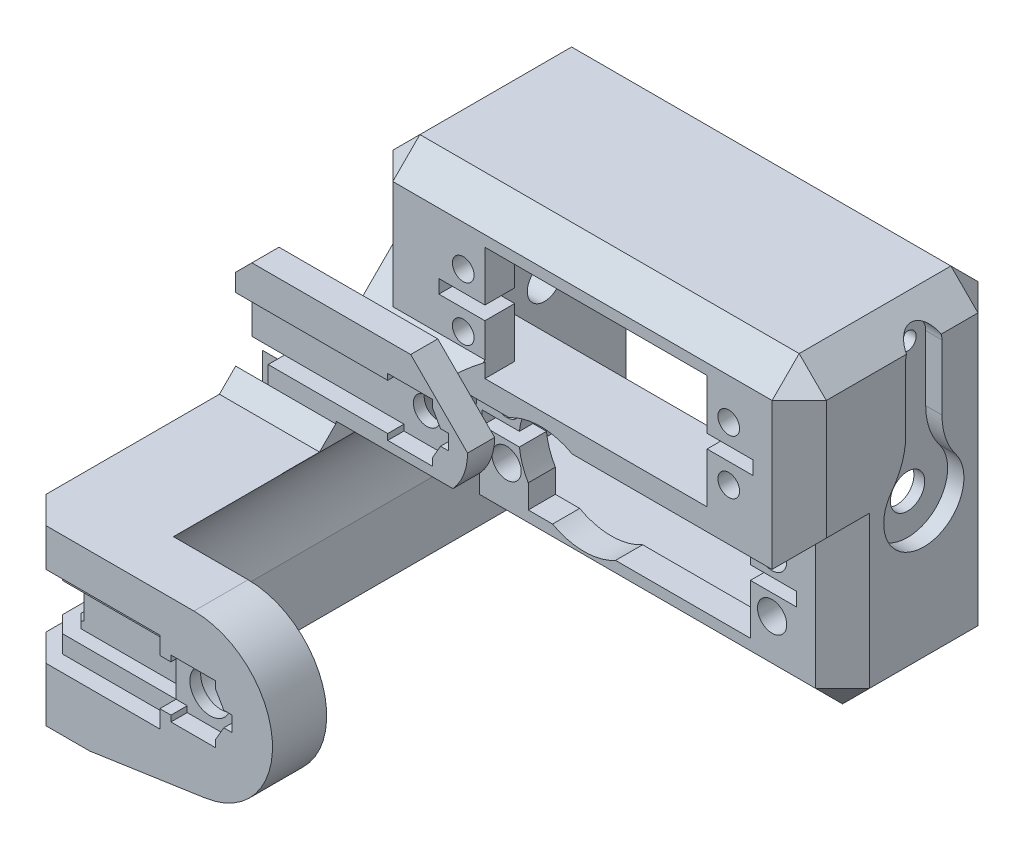
from build123d import *

# Parameters (mm, degrees)
ESQUISSE1_W               = 75
ESQUISSE1_H               = 60
BOSS_EXTRU_1_DEPTH        = 8
ESQUISSE2_W               = 41
ESQUISSE2_H               = 21
ENL_V_MAT_EXTRU_1_DEPTH   = 8
ESQUISSE3_W               = 8.5
ESQUISSE3_H               = 2.5
ENL_V_MAT_EXTRU_2_DEPTH   = 8
ESQUISSE4_R               = 2.7
ENL_V_MAT_EXTRU_3_DEPTH   = 49.685213361
SYM_TRIE4_COPY_1_SKETCH_W = 8.5
SYM_TRIE4_COPY_1_SKETCH_H = 2.5
SYM_TRIE4_COPY_1_DEPTH    = 8
SYM_TRIE4_COPY_2_SKETCH_R = 2.7
SYM_TRIE4_COPY_2_DEPTH    = 49.685213361
ESQUISSE6_W               = 75
ESQUISSE6_H               = 60
BOSS_EXTRU_2_DEPTH        = 35
ESQUISSE7_W               = 65
ESQUISSE7_H               = 50
ENL_V_MAT_EXTRU_4_DEPTH   = 35
CUT_EXTRUDE1_REACH        = 90.034
SKETCH1_W                 = 10
SKETCH1_H                 = 60
SKETCH2_W                 = 75
SKETCH2_H                 = 60
CUT_EXTRUDE2_DEPTH        = 3
SKETCH4_W                 = 30
SKETCH4_H                 = 60
BOSS_EXTRUDE2_DEPTH       = 5
CUT_EXTRUDE3_DEPTH        = 90.022469074
CUT_EXTRUDE3_DEPTH_BACK   = 90.022469074
SKETCH7_R                 = 3.175
SKETCH28_W                = 10
SKETCH28_H                = 12
BOSS_EXTRUDE7_DEPTH       = 3
CUT_EXTRUDE14_DEPTH       = 10
SKETCH31_W                = 10
SKETCH31_H                = 8
CUT_EXTRUDE17_DEPTH       = 10
SKETCH38_R                = 2
BOSS_EXTRUDE8_DEPTH       = 8
SKETCH39_W                = 65
SKETCH39_H                = 23
CUT_EXTRUDE22_DEPTH       = 7.5
BOSS_EXTRUDE9_DEPTH       = 72
SKETCH42_R                = 6.35
BOSS_EXTRUDE10_DEPTH      = 10
SKETCH43_R                = 14.5
SKETCH43_R_2              = 3.75
BOSS_EXTRUDE11_DEPTH      = 5
CUT_EXTRUDE23_DEPTH       = 3
SKETCH45_W                = 5
SKETCH45_H                = 21
BOSS_EXTRUDE12_DEPTH      = 45
CUT_EXTRUDE24_DEPTH       = 5
CUT_EXTRUDE25_DEPTH       = 3
SKETCH50_R                = 2.5
CUT_EXTRUDE26_DEPTH       = 5
CHAMFER1_SIZE             = 3
CUT_EXTRUDE29_DEPTH       = 5
CUT_EXTRUDE30_DEPTH       = 3
SKETCH53_R                = 1.6
CUT_EXTRUDE31_DEPTH       = 5
SKETCH54_W                = 19.063
SKETCH54_H                = 8.5
CUT_EXTRUDE32_DEPTH       = 3
SKETCH55_W                = 3
SKETCH55_H                = 8.5
CUT_EXTRUDE33_DEPTH       = 19.063
CUT_EXTRUDE35_REACH       = 116.5
SKETCH56_W                = 7
SKETCH56_H                = 1
CUT_EXTRUDE38_REACH       = 113.836
CUT_EXTRUDE39_START       = -25
SKETCH62_W                = 6
SKETCH62_H                = 5
CUT_EXTRUDE39_DEPTH       = 25
CUT_EXTRUDE40_START       = -5
SKETCH63_R                = 12
CUT_EXTRUDE40_DEPTH       = 5
CHAMFER3_SIZE             = 5
CUT_EXTRUDE41_DEPTH       = 24
CHAMFER4_SIZE             = 3
SKETCH65_W                = 3
SKETCH65_H                = 3
CUT_EXTRUDE42_DEPTH       = 3
SKETCH66_W                = 21.616473494
SKETCH66_H                = 4
CUT_EXTRUDE46_DEPTH       = 10
CUT_EXTRUDE48_REACH       = 116.5


with BuildPart() as part:
    # Esquisse1 → Boss.-Extru.1 (new body)
    with BuildSketch(Plane.XY):
        Rectangle(ESQUISSE1_W, ESQUISSE1_H)
    extrude(amount=-BOSS_EXTRU_1_DEPTH)

    # Esquisse2 → Enlèv. mat.-Extru.1 (cut)
    with BuildSketch(Plane.XY):
        with Locations((0, 12.5)):
            Rectangle(ESQUISSE2_W, ESQUISSE2_H)
    enl_v_mat_extru_1 = extrude(amount=-ENL_V_MAT_EXTRU_1_DEPTH, mode=Mode.SUBTRACT)

    # Esquisse3 → Enlèv. mat.-Extru.2 (cut)
    with BuildSketch(Plane.XY):
        with Locations((-24.75, 12.5)):
            Rectangle(ESQUISSE3_W, ESQUISSE3_H)
    enl_v_mat_extru_2 = extrude(amount=-ENL_V_MAT_EXTRU_2_DEPTH, mode=Mode.SUBTRACT)

    # Esquisse4 → Enlèv. mat.-Extru.3 (cut, through all)
    with BuildSketch(Plane.XY):
        with Locations((-24.5, 17.5)):
            Circle(ESQUISSE4_R)
        with Locations((-24.5, 7.5)):
            Circle(ESQUISSE4_R)
    enl_v_mat_extru_3 = extrude(amount=-ENL_V_MAT_EXTRU_3_DEPTH, mode=Mode.SUBTRACT)

    # Symétrie2: Enlèv. mat.-Extru.2, Enlèv. mat.-Extru.3 across plane
    add(enl_v_mat_extru_2.mirror(Plane(origin=(0, 0, 0), x_dir=(0, 0, 1), z_dir=(1, 0, 0))), mode=Mode.SUBTRACT)
    add(enl_v_mat_extru_3.mirror(Plane(origin=(0, 0, 0), x_dir=(0, 0, 1), z_dir=(1, 0, 0))), mode=Mode.SUBTRACT)

    # Symétrie4: Enlèv. mat.-Extru.1, Enlèv. mat.-Extru.2, Enlèv. mat.-Extru.3 across plane
    add(enl_v_mat_extru_1.mirror(Plane.ZX), mode=Mode.SUBTRACT)
    add(enl_v_mat_extru_2.mirror(Plane.ZX), mode=Mode.SUBTRACT)
    add(enl_v_mat_extru_3.mirror(Plane.ZX), mode=Mode.SUBTRACT)

    # Symétrie4 copy 1 sketch → Symétrie4 copy 1 (cut)
    with BuildSketch(Plane(origin=(0, 0, 0), x_dir=(-1, 0, 0), z_dir=(0, 0, 1))):
        with Locations((-24.75, 12.5)):
            Rectangle(SYM_TRIE4_COPY_1_SKETCH_W, SYM_TRIE4_COPY_1_SKETCH_H)
    extrude(amount=-SYM_TRIE4_COPY_1_DEPTH, mode=Mode.SUBTRACT)

    # Symétrie4 copy 2 sketch → Symétrie4 copy 2 (cut, through all)
    with BuildSketch(Plane(origin=(0, 0, 0), x_dir=(-1, 0, 0), z_dir=(0, 0, 1))):
        with Locations((-24.5, 17.5)):
            Circle(SYM_TRIE4_COPY_2_SKETCH_R)
        with Locations((-24.5, 7.5)):
            Circle(SYM_TRIE4_COPY_2_SKETCH_R)
    extrude(amount=-SYM_TRIE4_COPY_2_DEPTH, mode=Mode.SUBTRACT)

    # Esquisse6 → Boss.-Extru.2 (add)
    with BuildSketch(Plane.XY):
        Rectangle(ESQUISSE6_W, ESQUISSE6_H)
    extrude(amount=BOSS_EXTRU_2_DEPTH)

    # Esquisse7 → Enlèv. mat.-Extru.4 (cut)
    with BuildSketch(Plane.XY.offset(35)):
        Rectangle(ESQUISSE7_W, ESQUISSE7_H)
    extrude(amount=-ENL_V_MAT_EXTRU_4_DEPTH, mode=Mode.SUBTRACT)

    # Cut-Extrude1: up to this face of the body (flat: up to its plane)
    cut_extrude1_end = Plane(part.part.faces().sort_by_distance((-37.5, 0, 13.5))[0])
    # Sketch1 → Cut-Extrude1 (cut, up to the picked face)
    with BuildSketch(Plane(origin=(37.5, 0, 0), x_dir=(0, 0, -1), z_dir=(1, 0, 0)), mode=Mode.PRIVATE) as cut_extrude1_sk1:
        with Locations((-30, 0)):
            Rectangle(SKETCH1_W, SKETCH1_H)
    cut_extrude1_tool1 = split(extrude(cut_extrude1_sk1.sketch, amount=-CUT_EXTRUDE1_REACH, mode=Mode.PRIVATE), bisect_by=cut_extrude1_end, keep=Keep.BOTH, mode=Mode.PRIVATE)
    add(cut_extrude1_tool1.solids().sort_by(Axis((37.5, 0, 30), (-1, 0, 0)))[0], mode=Mode.SUBTRACT)

    # Sketch2 → Cut-Extrude2 (cut)
    with BuildSketch(Plane(origin=(0, 0, -8), x_dir=(-1, 0, 0), z_dir=(0, 0, -1))):
        Rectangle(SKETCH2_W, SKETCH2_H)
    extrude(amount=-CUT_EXTRUDE2_DEPTH, mode=Mode.SUBTRACT)

    # Sketch4 → Boss-Extrude2 (add)
    with BuildSketch(Plane.ZY.offset(37.5)):
        with Locations((10, 0)):
            Rectangle(SKETCH4_W, SKETCH4_H)
    extrude(amount=BOSS_EXTRUDE2_DEPTH)

    # Sketch7 → Cut-Extrude3 (cut, two sides: drawn at the far end of the back side and taken through both)
    with BuildSketch(Plane.ZY.offset(42.5).offset(-CUT_EXTRUDE3_DEPTH_BACK)):
        with Locations((10, 0)):
            Circle(SKETCH7_R)
    extrude(amount=CUT_EXTRUDE3_DEPTH + CUT_EXTRUDE3_DEPTH_BACK, mode=Mode.SUBTRACT)

    # Sketch28 → Boss-Extrude7 (add)
    with BuildSketch(Plane.ZY.offset(-32.5)):
        with Locations((10, 24)):
            Rectangle(SKETCH28_W, SKETCH28_H)
    extrude(amount=BOSS_EXTRUDE7_DEPTH)

    # Sketch27 → Cut-Extrude14 (cut)
    with BuildSketch(Plane.ZY.offset(-32.5)):
        Polygon((8.715395651, 26.225), (7.430791302, 24), (8.715395651, 21.775), (11.284604349, 21.775), (12.569208698, 24), (11.284604349, 26.225), align=None)
    extrude(amount=CUT_EXTRUDE14_DEPTH, mode=Mode.SUBTRACT)

    # Sketch31 → Cut-Extrude17 (cut)
    with BuildSketch(Plane.ZY.offset(-29.5)):
        with Locations((10, 23.5)):
            Rectangle(SKETCH31_W, SKETCH31_H)
    extrude(amount=CUT_EXTRUDE17_DEPTH, mode=Mode.SUBTRACT)

    # Sketch38 → Boss-Extrude8 (add)
    with BuildSketch(Plane(origin=(0, 0, -5), x_dir=(-1, 0, 0), z_dir=(0, 0, -1))):
        with BuildLine():
            Line((42.5, -2), (16.009475019, -2))
            ThreePointArc((16.009475019, -2), (10.2, -0.5), (4.390524981, -2))
            Line((4.390524981, -2), (-37.5, -2))
            Line((-37.5, -2), (-37.5, 30))
            Line((-37.5, 30), (42.5, 30))
            Line((42.5, 30), (42.5, -2))
        make_face()
        with Locations((-24.5, 17.5)):
            Circle(SKETCH38_R, mode=Mode.SUBTRACT)
        with Locations((-24.5, 7.5)):
            Circle(SKETCH38_R, mode=Mode.SUBTRACT)
        with Locations((24.5, 17.5)):
            Circle(SKETCH38_R, mode=Mode.SUBTRACT)
        with Locations((24.5, 7.5)):
            Circle(SKETCH38_R, mode=Mode.SUBTRACT)
        Polygon((-29, 13.75), (-20.5, 13.75), (-20.5, 23), (20.5, 23), (20.5, 13.75), (29, 13.75), (29, 11.25), (20.5, 11.25), (20.5, 2), (-20.5, 2), (-20.5, 11.25), (-29, 11.25), align=None, mode=Mode.SUBTRACT)
    extrude(amount=BOSS_EXTRUDE8_DEPTH)

    # Sketch39 → Cut-Extrude22 (cut)
    with BuildSketch(Plane.XY):
        with Locations((0, 13.5)):
            Rectangle(SKETCH39_W, SKETCH39_H)
    extrude(amount=-CUT_EXTRUDE22_DEPTH, mode=Mode.SUBTRACT)

    # Sketch40 → Boss-Extrude9 (add)
    with BuildSketch(Plane(origin=(0, 0, -5), x_dir=(-1, 0, 0), z_dir=(0, 0, -1))):
        with BuildLine():
            Line((23.974977314, 2), (42.5, 2))
            Line((42.5, 2), (42.5, -30))
            Line((42.5, -30), (29.473577412, -30))
            Line((29.473577412, -30), (29.473577412, -17.841274544))
            ThreePointArc((29.473577412, -17.841274544), (29.473577412, -7.158725456), (23.974977314, 2))
        make_face()
    extrude(amount=BOSS_EXTRUDE9_DEPTH)

    # Sketch42 → Boss-Extrude10 (add)
    with BuildSketch(Plane(origin=(0, 0, -77), x_dir=(-1, 0, 0), z_dir=(0, 0, -1))):
        with BuildLine():
            Line((42.5, -30), (29.473577412, -30))
            Line((29.473577412, -30), (8.08396994, -26.844769667))
            ThreePointArc((8.08396994, -26.844769667), (-4.261140345, -11.439141896), (10.2, 2))
            Line((10.2, 2), (42.5, 2))
            Line((42.5, 2), (42.5, -30))
        make_face()
        with Locations((10.2, -12.5)):
            Circle(SKETCH42_R, mode=Mode.SUBTRACT)
    extrude(amount=-BOSS_EXTRUDE10_DEPTH)

    # Sketch43 → Boss-Extrude11 (add)
    with BuildSketch(Plane(origin=(0, 0, -77), x_dir=(-1, 0, 0), z_dir=(0, 0, -1))):
        with Locations((10.2, -12.5)):
            Circle(SKETCH43_R)
        with Locations((10.2, -12.5)):
            Circle(SKETCH43_R_2, mode=Mode.SUBTRACT)
    extrude(amount=-BOSS_EXTRUDE11_DEPTH)

    # Sketch44 → Cut-Extrude23 (cut)
    with BuildSketch(Plane(origin=(0, 0, -77), x_dir=(-1, 0, 0), z_dir=(0, 0, -1))):
        Polygon((6.187, -7.15), (14.437, -7.15), (14.437, -8.25), (23.437, -8.25), (23.437, -16.75), (14.437, -16.75), (14.437, -17.85), (6.187, -17.85), (6.187, -16.498076211), (4.687, -13.9), (3.187, -13.9), (3.187, -11.1), (4.687, -11.1), (6.187, -8.501923789), align=None)
    extrude(amount=-CUT_EXTRUDE23_DEPTH, mode=Mode.SUBTRACT)

    # Sketch45 → Boss-Extrude12 (add)
    with BuildSketch(Plane.ZY.offset(42.5)):
        with Locations((-34.5, 12.5)):
            Rectangle(SKETCH45_W, SKETCH45_H)
    extrude(amount=-BOSS_EXTRUDE12_DEPTH)

    # Sketch46 → Cut-Extrude24 (cut)
    with BuildSketch(Plane(origin=(0, 0, -37), x_dir=(-1, 0, 0), z_dir=(0, 0, -1))):
        with BuildLine():
            Line((10.2, 23), (-2.5, 23))
            Line((-2.5, 23), (-2.5, 2))
            Line((-2.5, 2), (10.2, 2))
            ThreePointArc((10.2, 2), (-0.3, 12.5), (10.2, 23))
        make_face()
    extrude(amount=-CUT_EXTRUDE24_DEPTH, mode=Mode.SUBTRACT)

    # Sketch49 → Cut-Extrude25 (cut)
    with BuildSketch(Plane(origin=(0, 0, -37), x_dir=(-1, 0, 0), z_dir=(0, 0, -1))):
        Polygon((6.187, 17.85), (14.437, 17.85), (14.437, 16.75), (23.437, 16.75), (23.437, 8.25), (14.437, 8.25), (14.437, 7.15), (6.187, 7.15), (6.187, 8.501923789), (4.687, 11.1), (3.187, 11.1), (3.187, 13.9), (4.687, 13.9), (6.187, 16.498076211), align=None)
    extrude(amount=-CUT_EXTRUDE25_DEPTH, mode=Mode.SUBTRACT)

    # Sketch50 → Cut-Extrude26 (cut)
    with BuildSketch(Plane(origin=(0, 0, -37), x_dir=(-1, 0, 0), z_dir=(0, 0, -1))):
        with Locations(Location((10.2, 12.5, 0), (0, 0, 180))):
            Circle(SKETCH50_R)
    extrude(amount=-CUT_EXTRUDE26_DEPTH, mode=Mode.SUBTRACT)

    # Chamfer1
    # the kernel refuses this chamfer: 3 mm, written as the material it adds along each edge
    with BuildSketch(Plane(origin=(-16.25992835, 2, -13), x_dir=(0, 1, 0), z_dir=(-1, 0, 0))) as chamfer1_piece_1_section:
        Polygon((CHAMFER1_SIZE, 0), (0, CHAMFER1_SIZE), (0, 0), align=None)
    chamfer1_piece_1 = extrude(amount=26.24007165, mode=Mode.PRIVATE)
    chamfer1_piece_1 = chamfer1_piece_1 - Plane(origin=(-10.2, -12.5, -13), x_dir=(-0.9636788705869354, -0.26706372719687865, 0), z_dir=(0, 0, 1)) * Cylinder(20, 65, mode=Mode.PRIVATE)
    chamfer1_piece_1 = split(chamfer1_piece_1, bisect_by=Plane(origin=(-20.5, 2, -13), z_dir=(-1, 0, 0)), keep=Keep.TOP, mode=Mode.PRIVATE)
    add(chamfer1_piece_1)
    with BuildSketch(Plane(origin=(-42.5, 2, -37), x_dir=(0, 0, -1), z_dir=(1, 0, 0))) as chamfer1_piece_2_section:
        Polygon((CHAMFER1_SIZE, 0), (0, CHAMFER1_SIZE), (0, 0), align=None)
    chamfer1_piece_2 = extrude(amount=26.24007165, mode=Mode.PRIVATE)
    chamfer1_piece_2 = chamfer1_piece_2 - Plane(origin=(-10.2, -12.5, -37), x_dir=(-0.9636788705869354, -0.26706372719687865, 0), z_dir=(0, 0, 1)) * Cylinder(20, 65, mode=Mode.PRIVATE)
    add(chamfer1_piece_2)
    with BuildSketch(Plane(origin=(-42.5, 2, -32), x_dir=(0, 1, 0), z_dir=(1, 0, 0))) as chamfer1_piece_3_section:
        Polygon((CHAMFER1_SIZE, 0), (0, CHAMFER1_SIZE), (0, 0), align=None)
    chamfer1_piece_3 = extrude(amount=26.24007165, mode=Mode.PRIVATE)
    chamfer1_piece_3 = chamfer1_piece_3 - Plane(origin=(-10.2, -12.5, -32), x_dir=(-0.9636788705869354, -0.26706372719687865, 0), z_dir=(0, 0, 1)) * Cylinder(20, 65, mode=Mode.PRIVATE)
    add(chamfer1_piece_3)
    # the kernel refuses this chamfer: 3 mm, written as the material it takes off along each edge
    with BuildSketch(Plane(origin=(-42.5, 23, -44.715048964), x_dir=(1, 0, 0), z_dir=(0, 0, 1))) as chamfer1_2_piece_1:
        Polygon((CHAMFER1_SIZE, 0), (0, -CHAMFER1_SIZE), (0, 0), align=None)
    extrude(amount=20.430097928, mode=Mode.SUBTRACT)

    # Sketch51 → Cut-Extrude29 (cut)
    with BuildSketch(Plane(origin=(0, 0, -37), x_dir=(-1, 0, 0), z_dir=(0, 0, -1))):
        Polygon((10.2, 23), (-4.8, 8), (-4.8, 23), align=None)
    extrude(amount=-CUT_EXTRUDE29_DEPTH, mode=Mode.SUBTRACT)

    # Sketch52 → Cut-Extrude30 (cut)
    with BuildSketch(Plane(origin=(37.5, 0, 0), x_dir=(0, 0, -1), z_dir=(1, 0, 0))):
        with BuildLine():
            Line((-13.35, 12), (-13.35, 24))
            ThreePointArc((-13.35, 24), (-10, 27.35), (-6.65, 24))
            Line((-6.65, 24), (-6.65, 12))
            ThreePointArc((-6.65, 12), (-5.998758405, 8.033856538), (-4.113424043, 4.484219386))
            ThreePointArc((-4.113424043, 4.484219386), (-10, -7.4), (-15.886575957, 4.484219386))
            ThreePointArc((-15.886575957, 4.484219386), (-14.001241595, 8.033856538), (-13.35, 12))
        make_face()
    extrude(amount=-CUT_EXTRUDE30_DEPTH, mode=Mode.SUBTRACT)

    # Sketch53 → Cut-Extrude31 (cut)
    with BuildSketch(Plane(origin=(34.5, 0, 0), x_dir=(0, 0, -1), z_dir=(1, 0, 0))):
        with Locations((-10, 24)):
            Circle(SKETCH53_R)
    extrude(amount=-CUT_EXTRUDE31_DEPTH, mode=Mode.SUBTRACT)

    # Sketch54 → Cut-Extrude32 (cut)
    with BuildSketch(Plane(origin=(0, 0, -34), x_dir=(-1, 0, 0), z_dir=(0, 0, -1))):
        with Locations((32.9685, 12.5)):
            Rectangle(SKETCH54_W, SKETCH54_H)
    extrude(amount=CUT_EXTRUDE32_DEPTH, mode=Mode.SUBTRACT)

    # Sketch55 → Cut-Extrude33 (cut)
    with BuildSketch(Plane(origin=(-23.437, 0, 0), x_dir=(0, 0, -1), z_dir=(1, 0, 0))):
        with Locations((75.5, -12.5)):
            Rectangle(SKETCH55_W, SKETCH55_H)
    extrude(amount=-CUT_EXTRUDE33_DEPTH, mode=Mode.SUBTRACT)

    # Chamfer2
    # the kernel refuses this chamfer: 5 mm, written as the material it takes off along each edge
    with BuildSketch(Plane(origin=(34.166666667, 26.666666667, 21.666666667), x_dir=(0.7071067811865475, -0.7071067811865475, 0), z_dir=(0.577350269189626, 0.577350269189626, 0.5773502691896255)), Plane(origin=(34.166666667, -26.666666667, 21.666666667), x_dir=(-0.7071067811865475, -0.7071067811865475, 0), z_dir=(0.5773502691896257, -0.5773502691896257, 0.5773502691896257)), Plane(origin=(34.166666667, -26.666666667, -1.666666667), x_dir=(-0.7071067811865475, 0, -0.7071067811865475), z_dir=(0.5773502691896257, -0.5773502691896257, -0.5773502691896257)), Plane(origin=(-39.166666667, 26.666666667, -9.666666667), x_dir=(-0.707106781186547, -0.707106781186548, 0), z_dir=(-0.577350269189626, 0.5773502691896253, -0.577350269189626))) as chamfer2_piece_1:
        Polygon((-3.535533906, 2.041241452), (3.535533906, 2.041241452), (0, -4.082482905), align=None)
    extrude(amount=6.350852961, mode=Mode.SUBTRACT)
    with BuildSketch(Plane(origin=(-39.166666667, 26.666666667, 21.666666667), x_dir=(-0.7071067811865466, -0.7071067811865486, 0), z_dir=(-0.5773502691896267, 0.5773502691896251, 0.5773502691896255)), Plane(origin=(34.166666667, 26.666666667, -9.666666667), x_dir=(0.7071067811865475, -0.7071067811865475, 0), z_dir=(0.5773502691896257, 0.5773502691896257, -0.5773502691896257))) as chamfer2_piece_2:
        Polygon((-3.535533906, -2.041241452), (3.535533906, -2.041241452), (0, 4.082482905), align=None)
    extrude(amount=6.350852961, mode=Mode.SUBTRACT)
    with BuildSketch(Plane(origin=(50.35841494, 30, 25), x_dir=(0, -1, 0), z_dir=(-1, 0, 0)), Plane(origin=(50.35841494, -30, 25), x_dir=(0, 0, -1), z_dir=(-1, 0, 0))) as chamfer2_piece_3:
        with BuildLine():
            Line((5.141421356, 0.141421356), (-0.141421356, -5.141421356))
            Line((-0.141421356, -5.141421356), (-0.241421356, -5.141421356))
            ThreePointArc((-0.241421356, -5.141421356), (-0.1, -2.570710678), (-0.1, 0))
            Line((-0.1, 0), (0, 0.1))
            ThreePointArc((0, 0.1), (2.570710678, 0.1), (5.141421356, 0.241421356))
            Line((5.141421356, 0.241421356), (5.141421356, 0.141421356))
        make_face()
    extrude(amount=105.71682988, mode=Mode.SUBTRACT)
    with BuildSketch(Plane(origin=(37.5, 42.85841494, 25), x_dir=(-1, 0, 0), z_dir=(0, -1, 0))) as chamfer2_piece_4:
        with BuildLine():
            Line((5.141421356, -0.141421356), (-0.141421356, 5.141421356))
            Line((-0.141421356, 5.141421356), (-0.241421356, 5.141421356))
            ThreePointArc((-0.241421356, 5.141421356), (-0.1, 2.570710678), (-0.1, 0))
            Line((-0.1, 0), (0, -0.1))
            ThreePointArc((0, -0.1), (2.570710678, -0.1), (5.141421356, -0.241421356))
            Line((5.141421356, -0.241421356), (5.141421356, -0.141421356))
        make_face()
    extrude(amount=85.71682988, mode=Mode.SUBTRACT)
    with BuildSketch(Plane(origin=(37.5, 30, -25.85841494), x_dir=(-1, 0, 0), z_dir=(0, 0, 1)), Plane(origin=(-42.5, 30, 37.85841494), x_dir=(1, 0, 0), z_dir=(0, 0, -1))) as chamfer2_piece_5:
        with BuildLine():
            Line((5.141421356, -0.141421356), (-0.141421356, 5.141421356))
            Line((-0.141421356, 5.141421356), (-0.241421356, 5.141421356))
            ThreePointArc((-0.241421356, 5.141421356), (-0.1, 2.570710678), (-0.1, 0))
            Line((-0.1, 0), (0, -0.1))
            ThreePointArc((0, -0.1), (2.570710678, -0.1), (5.141421356, -0.241421356))
            Line((5.141421356, -0.241421356), (5.141421356, -0.141421356))
        make_face()
    extrude(amount=63.71682988, mode=Mode.SUBTRACT)
    with BuildSketch(Plane(origin=(37.5, -30, -17.85841494), x_dir=(-1, 0, 0), z_dir=(0, 0, 1))) as chamfer2_piece_6:
        with BuildLine():
            Line((5.141421356, 0.141421356), (-0.141421356, -5.141421356))
            Line((-0.141421356, -5.141421356), (-0.241421356, -5.141421356))
            ThreePointArc((-0.241421356, -5.141421356), (-0.1, -2.570710678), (-0.1, 0))
            Line((-0.1, 0), (0, 0.1))
            ThreePointArc((0, 0.1), (2.570710678, 0.1), (5.141421356, 0.241421356))
            Line((5.141421356, 0.241421356), (5.141421356, 0.141421356))
        make_face()
    extrude(amount=55.71682988, mode=Mode.SUBTRACT)
    with BuildSketch(Plane(origin=(-29.473577412, -30, -5), x_dir=(0, 0, 1), z_dir=(1, 0, 0))) as chamfer2_piece_7:
        with BuildLine():
            Line((5.141421356, 0.141421356), (-0.141421356, -5.141421356))
            Line((-0.141421356, -5.141421356), (-0.241421356, -5.141421356))
            ThreePointArc((-0.241421356, -5.141421356), (-0.1, -2.570710678), (-0.1, 0))
            Line((-0.1, 0), (0, 0.1))
            ThreePointArc((0, 0.1), (2.570710678, 0.1), (5.141421356, 0.241421356))
            Line((5.141421356, 0.241421356), (5.141421356, 0.141421356))
        make_face()
    extrude(amount=79.831992352, mode=Mode.SUBTRACT)
    with BuildSketch(Plane(origin=(-42.5, 42.85841494, 25), x_dir=(1, 0, 0), z_dir=(0, -1, 0))) as chamfer2_piece_8:
        with BuildLine():
            Line((5.141421356, 0.141421356), (-0.141421356, -5.141421356))
            Line((-0.141421356, -5.141421356), (-0.241421356, -5.141421356))
            ThreePointArc((-0.241421356, -5.141421356), (-0.1, -2.570710678), (-0.1, 0))
            Line((-0.1, 0), (0, 0.1))
            ThreePointArc((0, 0.1), (2.570710678, 0.1), (5.141421356, 0.241421356))
            Line((5.141421356, 0.241421356), (5.141421356, 0.141421356))
        make_face()
    extrude(amount=85.71682988, mode=Mode.SUBTRACT)
    with BuildSketch(Plane(origin=(37.5, -42.85841494, -5), x_dir=(0, 0, 1), z_dir=(0, 1, 0))) as chamfer2_piece_9:
        with BuildLine():
            Line((5.141421356, 0.141421356), (-0.141421356, -5.141421356))
            Line((-0.141421356, -5.141421356), (-0.241421356, -5.141421356))
            ThreePointArc((-0.241421356, -5.141421356), (-0.1, -2.570710678), (-0.1, 0))
            Line((-0.1, 0), (0, 0.1))
            ThreePointArc((0, 0.1), (2.570710678, 0.1), (5.141421356, 0.241421356))
            Line((5.141421356, 0.241421356), (5.141421356, 0.141421356))
        make_face()
    extrude(amount=40.85841494, mode=Mode.SUBTRACT)
    with BuildSketch(Plane(origin=(50.35841494, 30, -13), x_dir=(0, -1, 0), z_dir=(-1, 0, 0))) as chamfer2_piece_10:
        with BuildLine():
            Line((5.141421356, -0.141421356), (-0.141421356, 5.141421356))
            Line((-0.141421356, 5.141421356), (-0.241421356, 5.141421356))
            ThreePointArc((-0.241421356, 5.141421356), (-0.1, 2.570710678), (-0.1, 0))
            Line((-0.1, 0), (0, -0.1))
            ThreePointArc((0, -0.1), (2.570710678, -0.1), (5.141421356, -0.241421356))
            Line((5.141421356, -0.241421356), (5.141421356, -0.141421356))
        make_face()
    extrude(amount=105.71682988, mode=Mode.SUBTRACT)
    with BuildSketch(Plane(origin=(37.5, -14.85841494, -13), x_dir=(-1, 0, 0), z_dir=(0, 1, 0))) as chamfer2_piece_11:
        with BuildLine():
            Line((5.141421356, -0.141421356), (-0.141421356, 5.141421356))
            Line((-0.141421356, 5.141421356), (-0.241421356, 5.141421356))
            ThreePointArc((-0.241421356, 5.141421356), (-0.1, 2.570710678), (-0.1, 0))
            Line((-0.1, 0), (0, -0.1))
            ThreePointArc((0, -0.1), (2.570710678, -0.1), (5.141421356, -0.241421356))
            Line((5.141421356, -0.241421356), (5.141421356, -0.141421356))
        make_face()
    extrude(amount=57.71682988, mode=Mode.SUBTRACT)
    with BuildSketch(Plane(origin=(37.5, -2, -5), x_dir=(-1, 0, 0), z_dir=(0, 0, -1))) as chamfer2_piece_12:
        with BuildLine():
            Line((5.141421356, -0.141421356), (-0.141421356, 5.141421356))
            Line((-0.141421356, 5.141421356), (-0.241421356, 5.141421356))
            ThreePointArc((-0.241421356, 5.141421356), (-0.1, 2.570710678), (-0.1, 0))
            Line((-0.1, 0), (0, -0.1))
            ThreePointArc((0, -0.1), (2.570710678, -0.1), (5.141421356, -0.241421356))
            Line((5.141421356, -0.241421356), (5.141421356, -0.141421356))
        make_face()
    extrude(amount=20.85841494, mode=Mode.SUBTRACT)
    with BuildSketch(Plane(origin=(-42.5, -3.89158506, -77), x_dir=(1, 0, 0), z_dir=(0, -1, 0))) as chamfer2_piece_13:
        with BuildLine():
            Line((5.141421356, -0.141421356), (-0.141421356, 5.141421356))
            Line((-0.141421356, 5.141421356), (-0.241421356, 5.141421356))
            ThreePointArc((-0.241421356, 5.141421356), (-0.1, 2.570710678), (-0.1, 0))
            Line((-0.1, 0), (0, -0.1))
            ThreePointArc((0, -0.1), (2.570710678, -0.1), (5.141421356, -0.241421356))
            Line((5.141421356, -0.241421356), (5.141421356, -0.141421356))
        make_face()
    extrude(amount=38.96682988, mode=Mode.SUBTRACT)
    with BuildSketch(Plane(origin=(-42.5, 42.85841494, -13), x_dir=(1, 0, 0), z_dir=(0, -1, 0))) as chamfer2_piece_14_section:
        with BuildLine():
            Line((5.141421356, -0.141421356), (-0.141421356, 5.141421356))
            Line((-0.141421356, 5.141421356), (-0.241421356, 5.141421356))
            ThreePointArc((-0.241421356, 5.141421356), (-0.1, 2.570710678), (-0.1, 0))
            Line((-0.1, 0), (0, -0.1))
            ThreePointArc((0, -0.1), (2.570710678, -0.1), (5.141421356, -0.241421356))
            Line((5.141421356, -0.241421356), (5.141421356, -0.141421356))
        make_face()
    chamfer2_piece_14 = extrude(amount=50.71682988, mode=Mode.PRIVATE)
    chamfer2_piece_14 = split(chamfer2_piece_14, bisect_by=Plane(origin=(-42.5, 23.92920747, 5.92920747), z_dir=(0, 0.7071067811865476, -0.7071067811865476)), keep=Keep.TOP, mode=Mode.PRIVATE)
    add(chamfer2_piece_14, mode=Mode.SUBTRACT)
    with BuildSketch(Plane(origin=(-42.5, 14.85841494, -77), x_dir=(1, 0, 0), z_dir=(0, -1, 0))) as chamfer2_piece_15:
        with BuildLine():
            Line((5.141421356, -0.141421356), (-0.141421356, 5.141421356))
            Line((-0.141421356, 5.141421356), (-0.241421356, 5.141421356))
            ThreePointArc((-0.241421356, 5.141421356), (-0.1, 2.570710678), (-0.1, 0))
            Line((-0.1, 0), (0, -0.1))
            ThreePointArc((0, -0.1), (2.570710678, -0.1), (5.141421356, -0.241421356))
            Line((5.141421356, -0.241421356), (5.141421356, -0.141421356))
        make_face()
    extrude(amount=35.96682988, mode=Mode.SUBTRACT)
    with BuildSketch(Plane(origin=(37.5, -2, 7.85841494), x_dir=(-1, 0, 0), z_dir=(0, 0, -1))) as chamfer2_piece_16a_section:
        with BuildLine():
            Line((5.141421356, -0.141421356), (-0.141421356, 5.141421356))
            Line((-0.141421356, 5.141421356), (-0.241421356, 5.141421356))
            ThreePointArc((-0.241421356, 5.141421356), (-0.1, 2.570710678), (-0.1, 0))
            Line((-0.1, 0), (0, -0.1))
            ThreePointArc((0, -0.1), (2.570710678, -0.1), (5.141421356, -0.241421356))
            Line((5.141421356, -0.241421356), (5.141421356, -0.141421356))
        make_face()
    chamfer2_piece_16a = extrude(amount=33.71682988, mode=Mode.PRIVATE)
    chamfer2_piece_16a = split(chamfer2_piece_16a, bisect_by=Plane(origin=(37.5, -2, -5), z_dir=(0, 0, 1)), keep=Keep.TOP, mode=Mode.PRIVATE)
    with BuildSketch(Plane(origin=(37.5, -42.85841494, -5), x_dir=(0, 0, 1), z_dir=(0, 1, 0))) as chamfer2_piece_16b_section:
        with BuildLine():
            Line((5.141421356, 0.141421356), (-0.141421356, -5.141421356))
            Line((-0.141421356, -5.141421356), (-0.241421356, -5.141421356))
            ThreePointArc((-0.241421356, -5.141421356), (-0.1, -2.570710678), (-0.1, 0))
            Line((-0.1, 0), (0, 0.1))
            ThreePointArc((0, 0.1), (2.570710678, 0.1), (5.141421356, 0.241421356))
            Line((5.141421356, 0.241421356), (5.141421356, 0.141421356))
        make_face()
    chamfer2_piece_16b = extrude(amount=53.71682988, mode=Mode.PRIVATE)
    chamfer2_piece_16b = split(chamfer2_piece_16b, bisect_by=Plane(origin=(37.5, -2, -5), z_dir=(0, 1, 0)), keep=Keep.TOP, mode=Mode.PRIVATE)
    chamfer2_piece_16 = chamfer2_piece_16a & chamfer2_piece_16b
    add(chamfer2_piece_16, mode=Mode.SUBTRACT)

    # Cut-Extrude35: up to this face of the body (flat: up to its plane)
    cut_extrude35_end = Plane(part.part.faces().sort_by_distance((3.791843251, -11.473569169, -67))[0])
    # Sketch56 → Cut-Extrude35 (cut, up to the picked face)
    with BuildSketch(Plane(origin=(0, 0, -77), x_dir=(-1, 0, 0), z_dir=(0, 0, -1)), mode=Mode.PRIVATE) as cut_extrude35_sk1:
        with Locations((6.7, -12.5)):
            Rectangle(SKETCH56_W, SKETCH56_H)
    cut_extrude35_tool1 = split(extrude(cut_extrude35_sk1.sketch, amount=-CUT_EXTRUDE35_REACH, mode=Mode.PRIVATE), bisect_by=cut_extrude35_end, keep=Keep.BOTH, mode=Mode.PRIVATE)
    add(cut_extrude35_tool1.solids().sort_by(Axis((-6.7, -12.5, -77), (0, 0, 1)))[0], mode=Mode.SUBTRACT)


with BuildPart() as body_2:
    # Mirror1: read off the stored shape, not the designer's step
    # Mirror1: mirrored copy
    add(part.part.mirror(Plane.XY.offset(25)))


with BuildPart() as part_1:
    add(part.part)

    # Cut-Extrude38: up to this plane
    cut_extrude38_end = Plane(origin=(-42.5, 0, 20), z_dir=(-0.7071067811865505, 0, 0.7071067811865446))
    # Sketch61 → Cut-Extrude38 (cut, up to the surface)
    with BuildSketch(Plane(origin=(0, 0, -74), x_dir=(-1, 0, 0), z_dir=(0, 0, -1)), mode=Mode.PRIVATE) as cut_extrude38_sk1:
        Polygon((40.5, -8.25), (40.5, -5), (42.5, -5), (42.5, -20), (40.5, -20), (40.5, -16.75), (39, -16.75), (39, -8.25), align=None)
    cut_extrude38_tool1 = split(extrude(cut_extrude38_sk1.sketch, amount=-CUT_EXTRUDE38_REACH, mode=Mode.PRIVATE), bisect_by=cut_extrude38_end, keep=Keep.BOTH, mode=Mode.PRIVATE)
    add(cut_extrude38_tool1.solids().sort_by_distance((-40.97807, -12.5, -74))[0], mode=Mode.SUBTRACT)

    # Sketch62 → Cut-Extrude39 (cut)
    with BuildSketch(Plane(origin=(0, 8.25, 0), x_dir=(1, 0, 0), z_dir=(0, 1, 0)).offset(CUT_EXTRUDE39_START)):
        with Locations((-39.5, 34.5)):
            Rectangle(SKETCH62_W, SKETCH62_H)
    extrude(amount=CUT_EXTRUDE39_DEPTH, mode=Mode.SUBTRACT)

    # Sketch63 → Cut-Extrude40 (cut)
    with BuildSketch(Plane(origin=(0, 0, -5), x_dir=(-1, 0, 0), z_dir=(0, 0, -1)).offset(CUT_EXTRUDE40_START)):
        with Locations((10.2, -12.5)):
            Circle(SKETCH63_R)
    extrude(amount=CUT_EXTRUDE40_DEPTH, mode=Mode.SUBTRACT)

    # Chamfer3
    chamfer3_edges = [part_1.edges().sort_by_distance(p)[0] for p in [
        (-39, -12.5, -74),
    ]]
    chamfer(chamfer3_edges, length=CHAMFER3_SIZE)

    # Sketch64 → Cut-Extrude41 (cut)
    with BuildSketch(Plane.ZY.offset(40.5)):
        Polygon((-74, -20), (-77, -20), (-77, -5), (-74, -5), (-74, -8.25), (-71.5, -8.25), (-71.5, -16.75), (-74, -16.75), align=None)
    extrude(amount=-CUT_EXTRUDE41_DEPTH, mode=Mode.SUBTRACT)

    # Chamfer4
    # the kernel refuses this chamfer: 3 mm, written as the material it takes off along each edge
    with BuildSketch(Plane(origin=(-40.5, -15.965048964, -74), x_dir=(0, 0, 1), z_dir=(0, 1, 0)), Plane(origin=(-40.5, -20, -74), x_dir=(0, 0, 1), z_dir=(0, 1, 0))) as chamfer4_piece_1:
        Polygon((CHAMFER4_SIZE, 0), (0, CHAMFER4_SIZE), (0, 0), align=None)
    extrude(amount=10.965048964, mode=Mode.SUBTRACT)

    # Sketch65 → Cut-Extrude42 (cut)
    with BuildSketch(Plane(origin=(-55.75, 0, -55.75), x_dir=(-0.7071067811865498, 1.5097042871959244e-15, 0.7071067811865452), z_dir=(-0.7071067811865452, -1.5097042871959344e-15, -0.7071067811865498))):
        with Locations((-24.309397513, -6.5)):
            Rectangle(SKETCH65_W, SKETCH65_H)
        with Locations((-24.309397513, -18.5)):
            Rectangle(SKETCH65_W, SKETCH65_H)
    extrude(amount=-CUT_EXTRUDE42_DEPTH, mode=Mode.SUBTRACT)

    # Sketch66 → Cut-Extrude46 (cut, symmetric)
    with BuildSketch(Plane(origin=(0, 0, -37), x_dir=(-1, 0, 0), z_dir=(0, 0, -1))):
        with Locations((13.215993297, 3.46217775)):
            Rectangle(SKETCH66_W, SKETCH66_H)
    extrude(amount=CUT_EXTRUDE46_DEPTH, both=True, mode=Mode.SUBTRACT)

    # Cut-Extrude48: up to this face of the body (flat: up to its plane)
    cut_extrude48_end = Plane(part_1.part.faces().sort_by_distance((-26.50311601, -12.5, -71.5))[0])
    # Sketch67 → Cut-Extrude48 (cut, up to the picked face)
    with BuildSketch(Plane.XY.offset(25), mode=Mode.PRIVATE) as cut_extrude48_sk1:
        Polygon((-39, -8.25), (-36, -9.75), (-36, -15.25), (-39, -16.75), align=None)
    cut_extrude48_tool1 = split(extrude(cut_extrude48_sk1.sketch, amount=-CUT_EXTRUDE48_REACH, mode=Mode.PRIVATE), bisect_by=cut_extrude48_end, keep=Keep.BOTH, mode=Mode.PRIVATE)
    add(cut_extrude48_tool1.solids().sort_by(Axis((-37.607143, -12.5, 25), (0, 0, -1)))[0], mode=Mode.SUBTRACT)


with BuildPart() as body_2_2:
    # Mirror4: read off the stored shape, not the designer's step
    # Mirror4: mirrored copy
    add(part_1.part.mirror(Plane.XY.offset(25)))


solid = body_2_2.part
